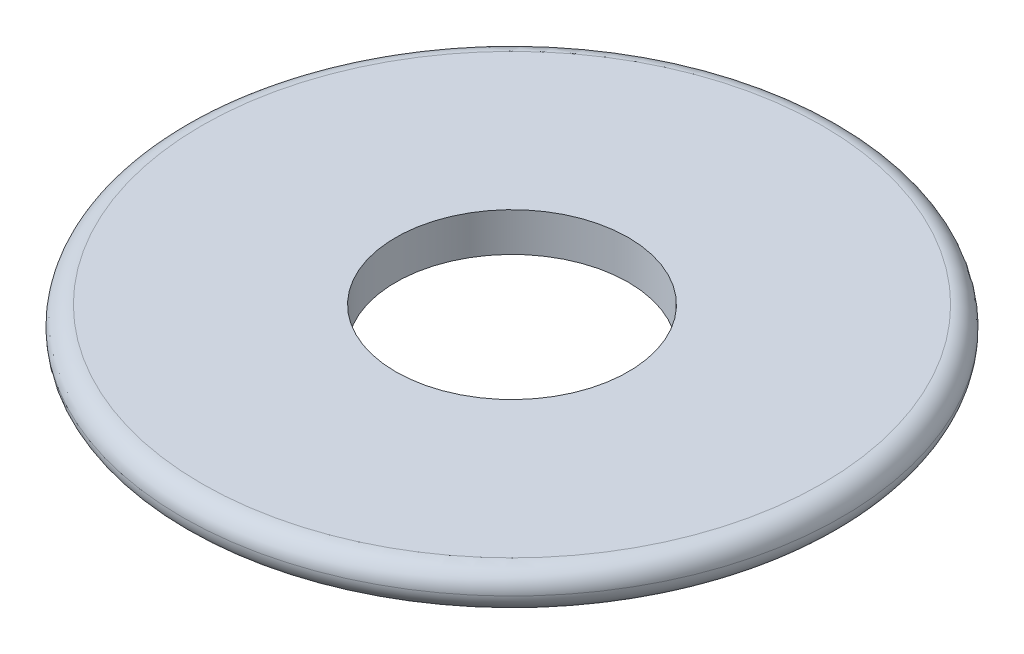
from build123d import *

# Parameters (mm, degrees)
ESBO_O1_R                = 8.5
ESBO_O1_R_2              = 3
RESSALTO_EXTRUS_O1_DEPTH = 1
FILETE1_R                = 0.5


with BuildPart() as part:
    # Esboço1 → Ressalto-extrusão1 (new body)
    with BuildSketch(Plane(origin=(0, 0, 0), x_dir=(1, 0, 0), z_dir=(0, 1, 0))):
        with Locations(Location((0, 0, 0), (0, 0, 270))):
            Circle(ESBO_O1_R)
        with Locations(Location((0, 0, 0), (0, 0, 270))):
            Circle(ESBO_O1_R_2, mode=Mode.SUBTRACT)
    extrude(amount=RESSALTO_EXTRUS_O1_DEPTH)

    # Filete1
    filete1_edges = [part.edges().sort_by_distance(p)[0] for p in [
        (0, 0, -8.5),
        (0, 1, -8.5),
    ]]
    fillet(filete1_edges, radius=FILETE1_R - 0.0001)  # a hair under: the kernel refuses the full size


solid = part.part
